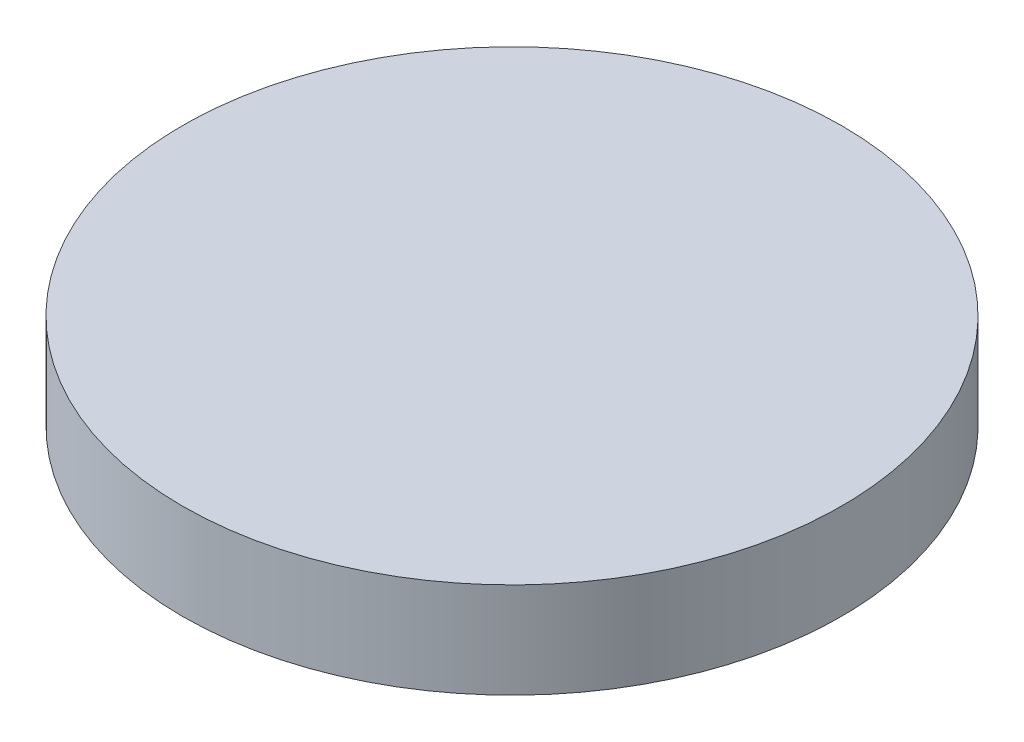
from build123d import *

# Parameters (mm, degrees)
SKETCH1_R           = 6.9
BOSS_EXTRUDE1_DEPTH = 2


with BuildPart() as part:
    # Sketch1 → Boss-Extrude1 (new body)
    with BuildSketch(Plane(origin=(0, 0, 0), x_dir=(1, 0, 0), z_dir=(0, 1, 0))):
        Circle(SKETCH1_R)
    extrude(amount=BOSS_EXTRUDE1_DEPTH)


solid = part.part
